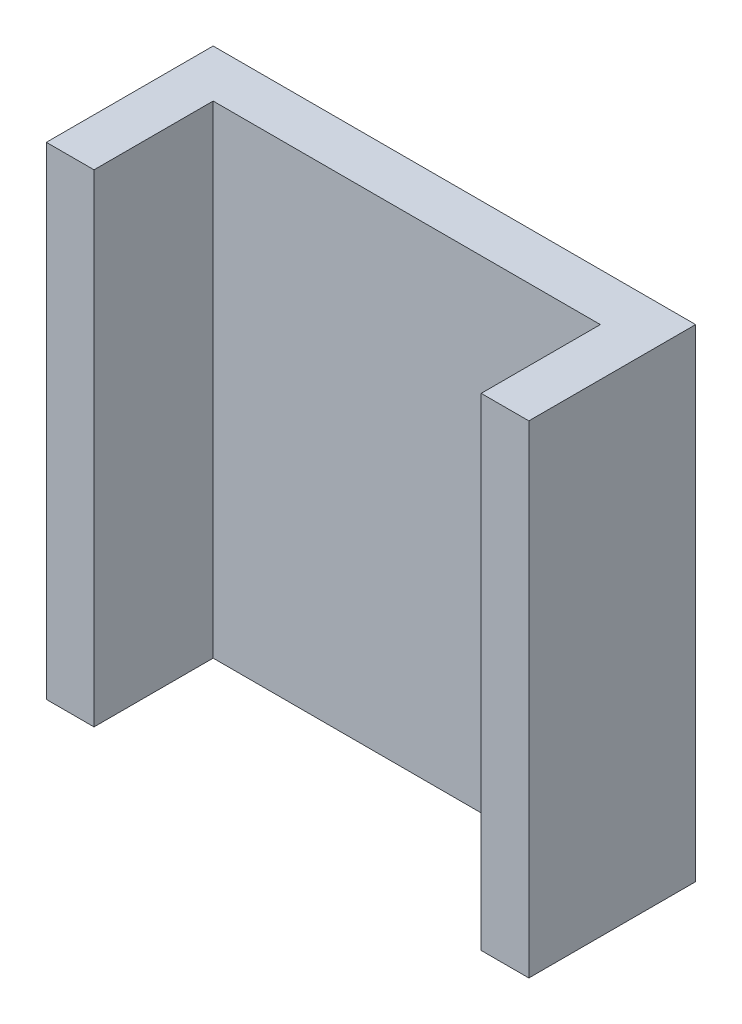
from build123d import *

# Parameters (mm, degrees)
ESQUISSE1_W        = 81
ESQUISSE1_H        = 81
BOSS_EXTRU_1_DEPTH = 8
ESQUISSE2_W        = 8
ESQUISSE2_H        = 81
BOSS_EXTRU_2_DEPTH = 20


with BuildPart() as part:
    # Esquisse1 → Boss.-Extru.1 (new body)
    with BuildSketch(Plane.XY):
        with Locations((40.5, 40.5)):
            Rectangle(ESQUISSE1_W, ESQUISSE1_H)
    extrude(amount=BOSS_EXTRU_1_DEPTH)

    # Esquisse2 → Boss.-Extru.2 (add)
    with BuildSketch(Plane.XY.offset(8)):
        with Locations((4, 40.5)):
            Rectangle(ESQUISSE2_W, ESQUISSE2_H)
        with Locations((77, 40.5)):
            Rectangle(ESQUISSE2_W, ESQUISSE2_H)
    extrude(amount=BOSS_EXTRU_2_DEPTH)


solid = part.part
